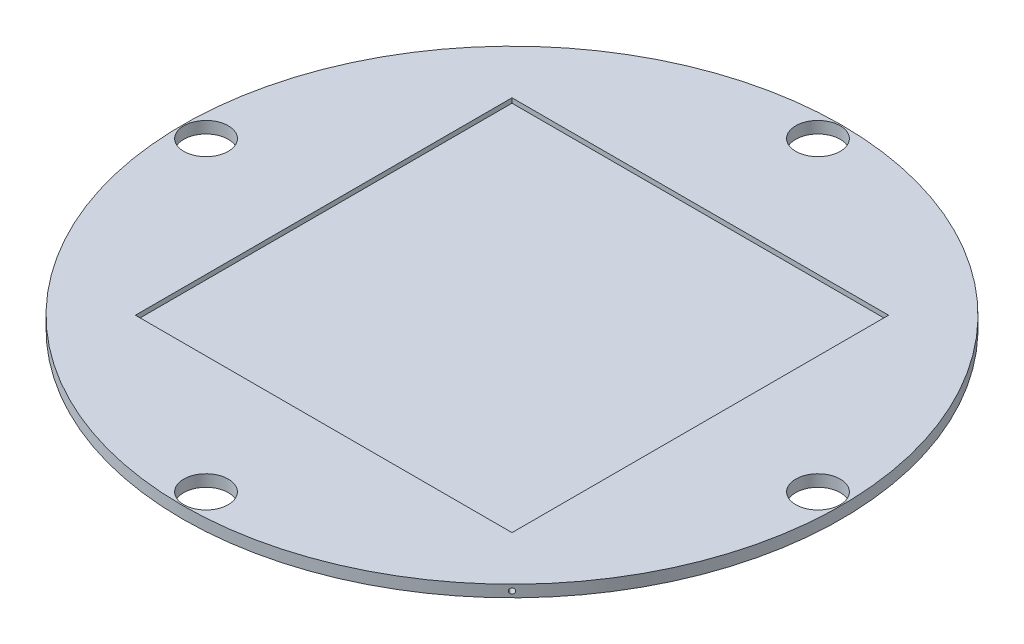
from build123d import *

# Parameters (mm, degrees)
SKETCH1_R           = 88.9
BOSS_EXTRUDE1_DEPTH = 3.175
SKETCH2_R           = 5.9944
CUT_EXTRUDE1_DEPTH  = 126.763669734
CIRPATTERN1_COUNT   = 4
SKETCH3_R           = 0.6985
CUT_EXTRUDE2_DEPTH  = 3.175
CIRPATTERN2_COUNT   = 4
SKETCH4_W           = 101.6
SKETCH4_H           = 101.6
CUT_EXTRUDE3_DEPTH  = 1.27


with BuildPart() as part:
    # Sketch1 → Boss-Extrude1 (new body)
    with BuildSketch(Plane(origin=(0, 0, 0), x_dir=(1, 0, 0), z_dir=(0, 1, 0))):
        Circle(SKETCH1_R)
    extrude(amount=BOSS_EXTRUDE1_DEPTH)

    # Sketch2 → Cut-Extrude1 (cut, through all)
    with BuildSketch(Plane(origin=(0, 3.175, 0), x_dir=(1, 0, 0), z_dir=(0, 1, 0))):
        with Locations((0, 82.55)):
            Circle(SKETCH2_R)
    cut_extrude1 = extrude(amount=-CUT_EXTRUDE1_DEPTH, mode=Mode.SUBTRACT)

    # CirPattern1: Cut-Extrude1 ×4 about axis
    cirpattern1_axis = Axis((0, 3.175, 0), (0, 1, 0))
    for i in range(1, CIRPATTERN1_COUNT):
        add(cut_extrude1.rotate(cirpattern1_axis, i * 360 / CIRPATTERN1_COUNT), mode=Mode.SUBTRACT)

    # Sketch3 → Cut-Extrude2 (cut)
    with BuildSketch(Plane(origin=(-62.861792847, 0, 62.861792847), x_dir=(0, -1, 0), z_dir=(-0.7071067811865488, 0, 0.7071067811865464))):
        with Locations((-1.5875, 0)):
            Circle(SKETCH3_R)
    cut_extrude2 = extrude(amount=-CUT_EXTRUDE2_DEPTH, mode=Mode.SUBTRACT)

    # CirPattern2: Cut-Extrude2 ×4 about axis
    cirpattern2_axis = Axis((0, 3.175, 0), (0, 1, 0))
    for i in range(1, CIRPATTERN2_COUNT):
        add(cut_extrude2.rotate(cirpattern2_axis, i * 360 / CIRPATTERN2_COUNT), mode=Mode.SUBTRACT)

    # Sketch4 → Cut-Extrude3 (cut)
    with BuildSketch(Plane(origin=(0, 3.175, 0), x_dir=(1, 0, 0), z_dir=(0, 1, 0))):
        Rectangle(SKETCH4_W, SKETCH4_H)
    extrude(amount=-CUT_EXTRUDE3_DEPTH, mode=Mode.SUBTRACT)


solid = part.part
